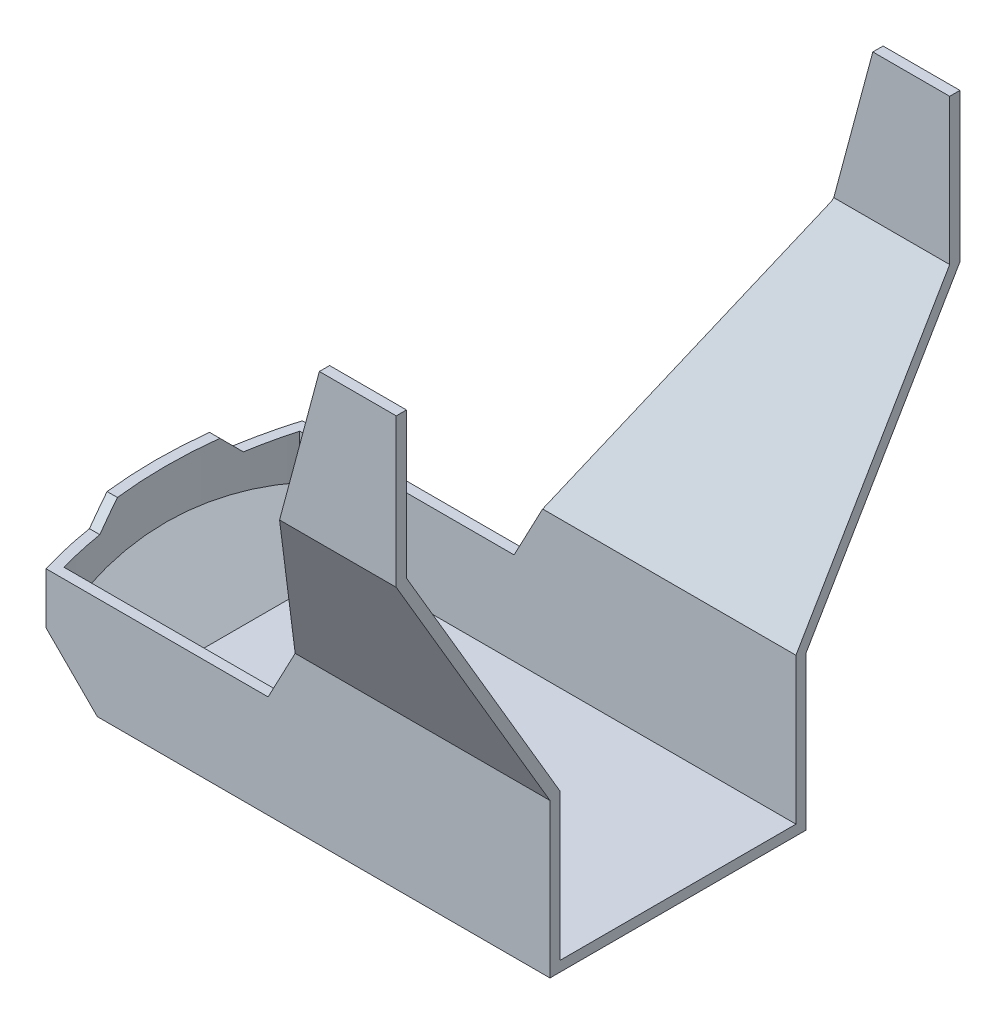
from build123d import *
from build123d.topology import SkipClean

# Parameters (mm, degrees)
BOSS_EXTRUDE1_DEPTH      = 20
CUT_EXTRUDE1_DEPTH       = 60.487961127
BOSS_EXTRUDE2_DEPTH      = 4
CHAMFER1_SIZE            = 4
BOSS_EXTRUDE3_DEPTH      = 30
BOSS_EXTRUDE3_DEPTH_BACK = 80
CUT_EXTRUDE2_DEPTH       = 163.896367878
SHELL1_START             = -17.663350197
SHELL1_DEPTH             = 97.938189841
SHELL1_START_2           = -19.725064534
SHELL1_2_OUTLINE_W       = 18
SHELL1_2_OUTLINE_H       = 46
SHELL1_2_DEPTH           = 3.170813997
SHELL1_START_3           = 4.138253986
SHELL1_3_DEPTH           = 15.861746014
SHELL1_START_4           = -11.021607192
SHELL1_4_DEPTH           = 5.325277307
SHELL1_START_5           = -5.696329885
SHELL1_5_DEPTH           = 2


with BuildPart() as part:
    # Sketch1 → Boss-Extrude1 (new body)
    with BuildSketch(Plane(origin=(0, 0, 0), x_dir=(1, 0, 0), z_dir=(0, 1, 0))):
        with BuildLine():
            Line((25.274839644, -23.491941756), (25.274839644, 16.508058244))
            Line((25.274839644, 16.508058244), (-18.05582698, 16.508058244))
            ThreePointArc((-18.05582698, 16.508058244), (-21.573303396, -3.353843819), (-20.422301498, -23.491941756))
            ThreePointArc((-20.422301498, -23.491941756), (-19.386839701, -28.526912443), (-18.05582698, -33.491941756))
            Line((-18.05582698, -33.491941756), (25.274839644, -33.491941756))
            Line((25.274839644, -33.491941756), (25.274839644, -23.491941756))
        make_face()
    extrude(amount=BOSS_EXTRUDE1_DEPTH)

    # Sketch2 → Cut-Extrude1 (cut, through all)
    with BuildSketch(Plane.XY.offset(33.491941756)):
        Polygon((-18.05582698, 10), (-18.05582698, 0), (-8.05582698, 0), align=None)
        Polygon((-8.05582698, 0), (-18.05582698, 0), (-18.05582698, 10), (-26.022793605, 17.966966625), (-26.022793605, -4.913514026), (-8.05582698, -4.913514026), align=None)
    extrude(amount=-CUT_EXTRUDE1_DEPTH, mode=Mode.SUBTRACT)

    # Sketch3 → Boss-Extrude2 (add)
    with BuildSketch(Plane(origin=(0, 20, 0), x_dir=(1, 0, 0), z_dir=(0, 1, 0))):
        with BuildLine():
            Line((-20.591335302, 5.508058244), (-18.56429203, 5.508058244))
            ThreePointArc((-18.56429203, 5.508058244), (-19.725160356, -8.491941756), (-18.56429203, -22.491941756))
            Line((-18.56429203, -22.491941756), (-20.591335302, -22.491941756))
            ThreePointArc((-20.591335302, -22.491941756), (-21.725160356, -8.491941756), (-20.591335302, 5.508058244))
        make_face()
    extrude(amount=BOSS_EXTRUDE2_DEPTH)

    # Chamfer1
    chamfer1_edges = [part.edges().sort_by_distance(p)[0] for p in [
        (-19.577813666, 24, -5.508058244),
        (-19.577813666, 24, 22.491941756),
    ]]
    chamfer(chamfer1_edges, length=CHAMFER1_SIZE - 0.0001)  # a hair under: the kernel refuses the full size

    # Sketch4 → Boss-Extrude3 (add, two sides: drawn at the far end of the back side and taken through both)
    with BuildSketch(Plane.XY.offset(33.491941756).offset(-BOSS_EXTRUDE3_DEPTH_BACK)):
        Polygon((65.274839644, 110), (57.510268291, 81.022225211), (25.274839644, 20), (25.274839644, 0), (80.274839644, 0), (80.274839644, 110), align=None)
    extrude(amount=BOSS_EXTRUDE3_DEPTH + BOSS_EXTRUDE3_DEPTH_BACK)

    # Sketch5 → Cut-Extrude2 (cut, through all)
    with BuildSketch(Plane(origin=(80.274839644, 0, 0), x_dir=(0, 0, -1), z_dir=(1, 0, 0))):
        Polygon((-63.491941756, 0), (-33.491941756, 0), (-33.491941756, 30), (-63.491941756, 81.022225211), align=None)
    cut_extrude2 = extrude(amount=-CUT_EXTRUDE2_DEPTH, mode=Mode.SUBTRACT)

    # Mirror1: Cut-Extrude2 across plane
    add(cut_extrude2.mirror(Plane.XY.offset(8.491941756)), mode=Mode.SUBTRACT)

    # Shell1: read off the stored shape, not the designer's step
    # Shell1 outline → Shell1 (cut)
    with BuildSketch(Plane.YZ.offset(SHELL1_START)):
        Polygon((2, 31.491941756), (2, -14.508058244), (30.544412087, -14.508058244), (81.566637298, -44.508058244), (110, -44.508058244), (110, 61.491941756), (81.566637298, 61.491941756), (30.544412087, 31.491941756), align=None)
    extrude(amount=SHELL1_DEPTH, mode=Mode.SUBTRACT)

    # Shell1 2 outline → Shell1 2 (cut)
    with BuildSketch(Plane.YZ.offset(SHELL1_START_2)):
        with Locations((11, 8.491941756)):
            Rectangle(SHELL1_2_OUTLINE_W, SHELL1_2_OUTLINE_H)
    extrude(amount=SHELL1_2_DEPTH, mode=Mode.SUBTRACT)

    # Shell1 3 outline → Shell1 3 (add)
    with SkipClean():  # the faces are left unmerged after this step: merging them gives an invalid solid
        with BuildSketch(Plane(origin=(0, 0, 0), x_dir=(1, 0, 0), z_dir=(0, 1, 0)).offset(SHELL1_START_3)):
            with BuildLine():
                ThreePointArc((-19.725064534, -27.039617882), (-19.20680208, -29.272995907), (-18.62986821, -31.491941756))
                Line((-18.62986821, -31.491941756), (-16.554250537, -31.491941756))
                ThreePointArc((-16.554250537, -31.491941756), (-18.92870145, -20.100717198), (-19.725160356, -8.491941756))
                Line((-19.725160356, -8.491941756), (-19.725064534, -27.039617882))
            make_face()
            with BuildLine():
                ThreePointArc((-18.62986821, 14.508058244), (-19.20680208, 12.289112394), (-19.725064535, 10.055734369))
                Line((-19.725064535, 10.055734369), (-19.725160356, -8.491941756))
                ThreePointArc((-19.725160356, -8.491941756), (-18.92870145, 3.116833686), (-16.554250537, 14.508058244))
                Line((-16.554250537, 14.508058244), (-18.62986821, 14.508058244))
            make_face()
        extrude(amount=SHELL1_3_DEPTH)

    # Shell1 4 outline → Shell1 4 (cut)
    with SkipClean():  # the faces are left unmerged after this step: merging them gives an invalid solid
        with BuildSketch(Plane(origin=(0, 0, 0), x_dir=(0.7071067811865509, -0.707106781186544, 0), z_dir=(0.707106781186544, 0.707106781186551, 0)).offset(SHELL1_START_4)):
            with BuildLine():
                Line((-5.696329885, 16.508058244), (-19.838465509, 16.508058244))
                add(Edge.make_bspline(
                    [(-19.838465509, 16.508058244), (-30.445406654, -8.491941756), (-19.838465509, -33.491941756)],
                    knots=[2.850127051, 2.850127051, 2.850127051, 3.433058256, 3.433058256, 3.433058256], degree=2, weights=[1, 0.957823754, 1]))
                Line((-19.838465509, -33.491941756), (-5.696329885, -33.491941756))
                Line((-5.696329885, -33.491941756), (-5.696329885, 16.508058244))
            make_face()
        extrude(amount=SHELL1_4_DEPTH, mode=Mode.SUBTRACT)

    # Shell1 5 outline → Shell1 5 (add)
    with SkipClean():  # the faces are left unmerged after this step: merging them gives an invalid solid
        with BuildSketch(Plane(origin=(0, 0, 0), x_dir=(0.7071067811865509, -0.707106781186544, 0), z_dir=(0.707106781186544, 0.707106781186551, 0)).offset(SHELL1_START_5)):
            with BuildLine():
                Line((-6.52475701, -31.491941756), (-6.52475701, 14.508058244))
                Line((-6.52475701, 14.508058244), (-19.71491574, 14.508058244))
                add(Edge.make_bspline(
                    [(-19.71491574, 14.508058244), (-28.857373182, -8.491941756), (-19.71491574, -31.491941756)],
                    knots=[2.867588645, 2.867588645, 2.867588645, 3.415596662, 3.415596662, 3.415596662], degree=2, weights=[1, 0.962695179, 1]))
                Line((-19.71491574, -31.491941756), (-6.52475701, -31.491941756))
            make_face()
        extrude(amount=SHELL1_5_DEPTH)


solid = part.part
